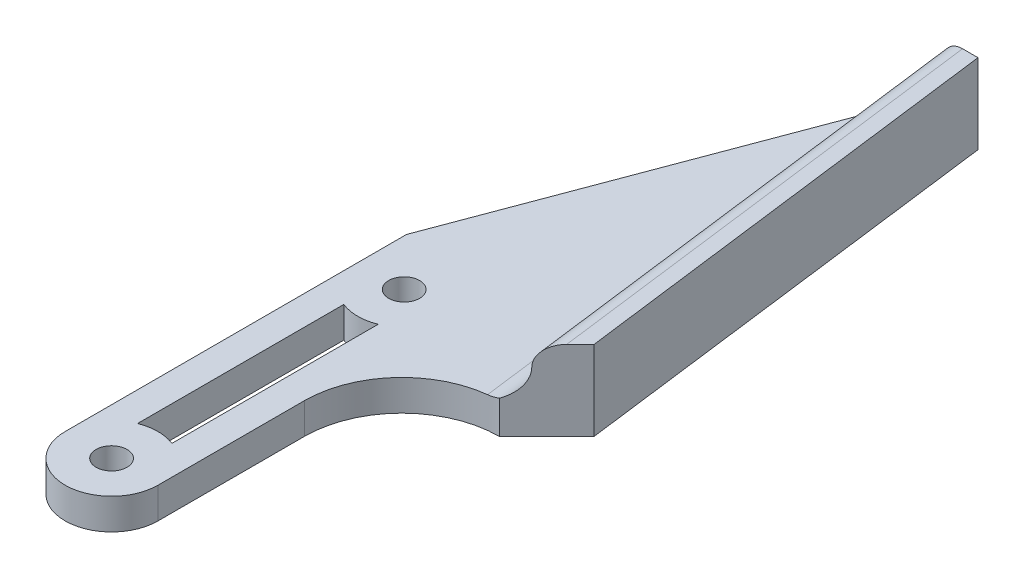
from build123d import *

# Parameters (mm, degrees)
CROQUIS1_R              = 1.5875
SALIENTE_EXTRUIR1_DEPTH = 3.175
CORTAR_EXTRUIR1_DEPTH   = 3.175
CORTAR_EXTRUIR3_DEPTH   = 10
CORTAR_EXTRUIR8_DEPTH   = 10
BOSS_EXTRU_1_DEPTH      = 5
CONG_1_R                = 2
CONG_2_R                = 3


with BuildPart() as part:
    # Croquis1 → Saliente-Extruir1 (new body)
    with BuildSketch(Plane(origin=(0, 0, 0), x_dir=(1, 0, 0), z_dir=(0, 1, 0))):
        with BuildLine():
            Line((-12.5, 0), (-12.5, -40))
            Line((-12.5, -40), (-2.975, -40))
            Line((-2.975, -40), (-2.975, -20))
            ThreePointArc((-2.975, -20), (-0.046067812, -12.928932188), (7.025, -10))
            Line((7.025, -10), (12.5, -10))
            Line((12.5, -10), (12.5, 40))
            Line((12.5, 40), (2.5, 40))
            Line((2.5, 40), (-12.5, 0))
        make_face()
        with Locations(Location((-7.7375, -5, 0), (0, 0, 270))):
            Circle(CROQUIS1_R, mode=Mode.SUBTRACT)
        with Locations(Location((-7.7375, -35, 0), (0, 0, 270))):
            Circle(CROQUIS1_R, mode=Mode.SUBTRACT)
    extrude(amount=SALIENTE_EXTRUIR1_DEPTH)

    # Croquis2 → Cortar-Extruir1 (cut)
    with BuildSketch(Plane(origin=(0, 3.175, 0), x_dir=(1, 0, 0), z_dir=(0, 1, 0))):
        Polygon((12.5, -10), (6.1, 40), (12.5, 40), align=None)
    extrude(amount=-CORTAR_EXTRUIR1_DEPTH, mode=Mode.SUBTRACT)

    # Croquis3 → Cortar-Extruir3 (cut)
    with BuildSketch(Plane(origin=(0, 3.175, 0), x_dir=(1, 0, 0), z_dir=(0, 1, 0))):
        with BuildLine():
            ThreePointArc((-5.975, -30.575635639), (-7.7375, -30.2375), (-9.5, -30.575635639))
            Line((-9.5, -30.575635639), (-9.5, -9.427055314))
            ThreePointArc((-9.5, -9.427055314), (-7.7375, -9.765), (-5.975, -9.427055314))
            Line((-5.975, -9.427055314), (-5.975, -14.803847577))
            Line((-5.975, -14.803847577), (-5.975, -30.575635639))
        make_face()
        with BuildLine():
            ThreePointArc((-12.5, -35), (-7.7375, -39.7625), (-2.975, -35))
            Line((-2.975, -35), (-2.975, -40))
            Line((-2.975, -40), (-12.5, -40))
            Line((-12.5, -40), (-12.5, -35))
        make_face()
    extrude(amount=-CORTAR_EXTRUIR3_DEPTH, mode=Mode.SUBTRACT)

    # Croquis5 → Cortar-Extruir8 (cut)
    with BuildSketch(Plane(origin=(0, 3.175, 0), x_dir=(1, 0, 0), z_dir=(0, 1, 0))):
        Polygon((7.025, -10), (11.878723404, -5.146276596), (12.5, -10), align=None)
    extrude(amount=-CORTAR_EXTRUIR8_DEPTH, mode=Mode.SUBTRACT)

    # Esquisse1 → Boss.-Extru.1 (add)
    with BuildSketch(Plane(origin=(0, 3.175, 0), x_dir=(1, 0, 0), z_dir=(0, 1, 0))):
        Polygon((11.878723404, -5.146276596), (6.1, 40), (2.5, 40), (8.687234043, -8.337765957), align=None)
    extrude(amount=BOSS_EXTRU_1_DEPTH)

    # Congé1
    cong_1_edges = [part.edges().sort_by_distance(p)[0] for p in [
        (5.593617021, 8.175, -15.831117021),
    ]]
    fillet(cong_1_edges, radius=CONG_1_R)

    # Congé2
    cong_2_edges = [part.edges().sort_by_distance(p)[0] for p in [
        (5.593617021, 3.175, -15.831117021),
    ]]
    fillet(cong_2_edges, radius=CONG_2_R - 0.0001)  # a hair under: the kernel refuses the full size


solid = part.part
